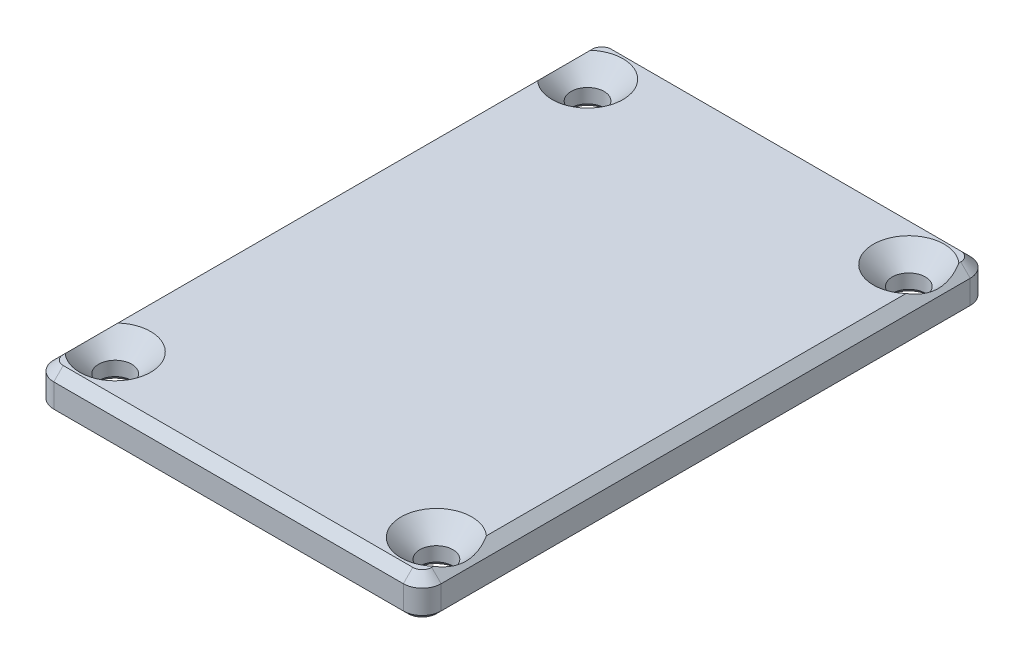
from build123d import *

# Parameters (mm, degrees)
SKETCH_1_W          = 41
SKETCH_1_H          = 60
EXTRUDE_1_DEPTH     = 4
SKETCH_2_R          = 1.75
CUT_EXTRUDE_1_DEPTH = 37.554753453
FILLET_1_R          = 2
CHAMFER_2_SIZE      = 1
CHAMFER_1_SIZE      = 2
CHAMFER_3_SIZE      = 0.5


with BuildPart() as part:
    # Эскиз1 → Бобышка-Вытянуть1 (new body)
    with BuildSketch(Plane(origin=(0, 0, 0), x_dir=(1, 0, 0), z_dir=(0, 1, 0))):
        Rectangle(SKETCH_1_W, SKETCH_1_H)
    extrude(amount=EXTRUDE_1_DEPTH)

    # Эскиз2 → Вырез-Вытянуть1 (cut, through all)
    with BuildSketch(Plane(origin=(0, 4, 0), x_dir=(1, 0, 0), z_dir=(0, 1, 0))):
        with Locations(Location((17, 25, 0), (0, 0, 270))):
            Circle(SKETCH_2_R)
        with Locations(Location((17, -25, 0), (0, 0, 90))):
            Circle(SKETCH_2_R)
        with Locations(Location((-17, -25, 0), (0, 0, 270))):
            Circle(SKETCH_2_R)
        with Locations(Location((-17, 25, 0), (0, 0, 90))):
            Circle(SKETCH_2_R)
    extrude(amount=-CUT_EXTRUDE_1_DEPTH, mode=Mode.SUBTRACT)

    # Скругление1
    fillet_1_edges = [part.edges().sort_by_distance(p)[0] for p in [
        (20.5, 2, 30),
        (-20.5, 2, 30),
        (-20.5, 2, -30),
        (20.5, 2, -30),
    ]]
    fillet(fillet_1_edges, radius=FILLET_1_R)

    # Фаска2
    chamfer_2_edges = [part.edges().sort_by_distance(p)[0] for p in [
        (0, 4, -30),
        (20.5, 4, 0),
        (-20.5, 4, 0),
        (0, 4, 30),
        (19.914213562, 4, 29.414213562),
        (-19.914213562, 4, 29.414213562),
        (-19.914213562, 4, -29.414213562),
        (19.914213562, 4, -29.414213562),
    ]]
    chamfer(chamfer_2_edges, length=CHAMFER_2_SIZE)

    # Фаска1
    # the kernel refuses this chamfer: 2 mm, written as the material it takes off along each edge
    with BuildSketch(Plane(origin=(-17, 4, -25), x_dir=(0, 0, -1), z_dir=(1, 0, 0))) as chamfer_1_piece_1:
        Polygon((1.75 + CHAMFER_1_SIZE, 0), (1.75, -CHAMFER_1_SIZE), (1.75, 0), align=None)
    revolve(axis=Axis((-17, 4, -25), (0, 1, 0)), mode=Mode.SUBTRACT)
    with BuildSketch(Plane(origin=(-17, 4, 25), x_dir=(0, 0, 1), z_dir=(-1, 0, 0))) as chamfer_1_piece_2:
        Polygon((1.75 + CHAMFER_1_SIZE, 0), (1.75, -CHAMFER_1_SIZE), (1.75, 0), align=None)
    revolve(axis=Axis((-17, 4, 25), (0, 1, 0)), mode=Mode.SUBTRACT)
    with BuildSketch(Plane(origin=(17, 4, 25), x_dir=(0, 0, -1), z_dir=(1, 0, 0))) as chamfer_1_piece_3:
        Polygon((1.75 + CHAMFER_1_SIZE, 0), (1.75, -CHAMFER_1_SIZE), (1.75, 0), align=None)
    revolve(axis=Axis((17, 4, 25), (0, 1, 0)), mode=Mode.SUBTRACT)
    with BuildSketch(Plane(origin=(17, 4, -25), x_dir=(0, 0, 1), z_dir=(-1, 0, 0))) as chamfer_1_piece_4:
        Polygon((1.75 + CHAMFER_1_SIZE, 0), (1.75, -CHAMFER_1_SIZE), (1.75, 0), align=None)
    revolve(axis=Axis((17, 4, -25), (0, 1, 0)), mode=Mode.SUBTRACT)

    # Фаска3
    chamfer_3_edges = [part.edges().sort_by_distance(p)[0] for p in [
        (-17, 0, -23.25),
        (-17, 0, 23.25),
        (17, 0, 26.75),
        (17, 0, -26.75),
        (0, 0, -30),
        (20.5, 0, 0),
        (0, 0, 30),
        (-20.5, 0, 0),
        (19.914213562, 0, 29.414213562),
        (-19.914213562, 0, 29.414213562),
        (-19.914213562, 0, -29.414213562),
        (19.914213562, 0, -29.414213562),
    ]]
    chamfer(chamfer_3_edges, length=CHAMFER_3_SIZE)


solid = part.part
